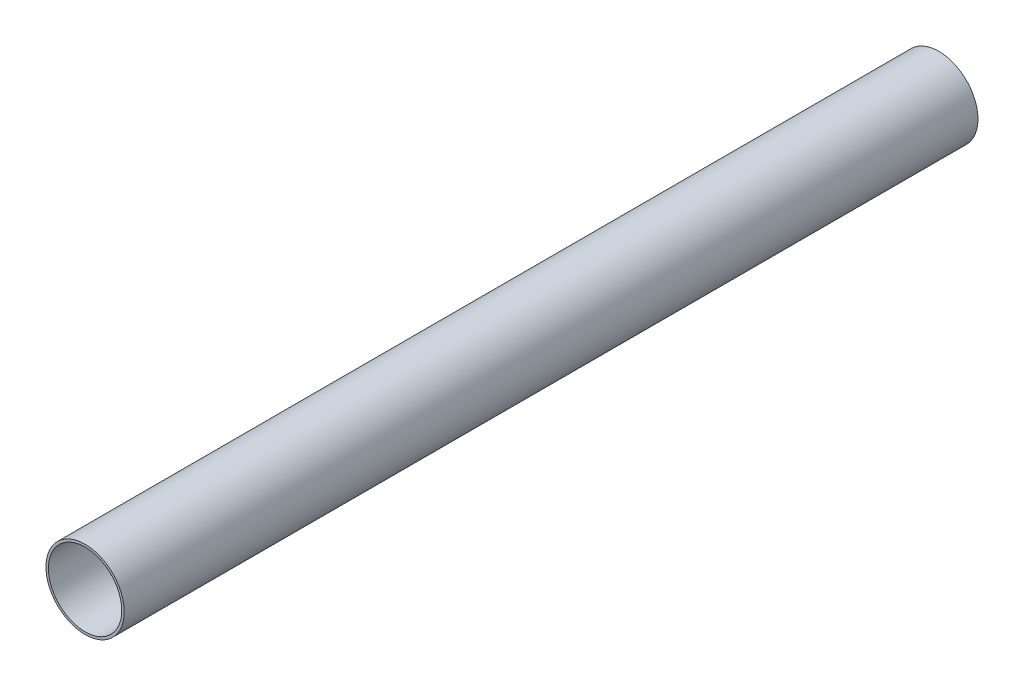
from build123d import *

# Parameters (mm, degrees)
SKETCH1_R           = 25.4
SKETCH1_R_2         = 23.8125
BOSS_EXTRUDE1_DEPTH = 277.01875


with BuildPart() as part:
    # Sketch1 → Boss-Extrude1 (new, symmetric)
    with BuildSketch(Plane.XY):
        Circle(SKETCH1_R)
        Circle(SKETCH1_R_2, mode=Mode.SUBTRACT)
    extrude(amount=BOSS_EXTRUDE1_DEPTH, both=True)


solid = part.part
